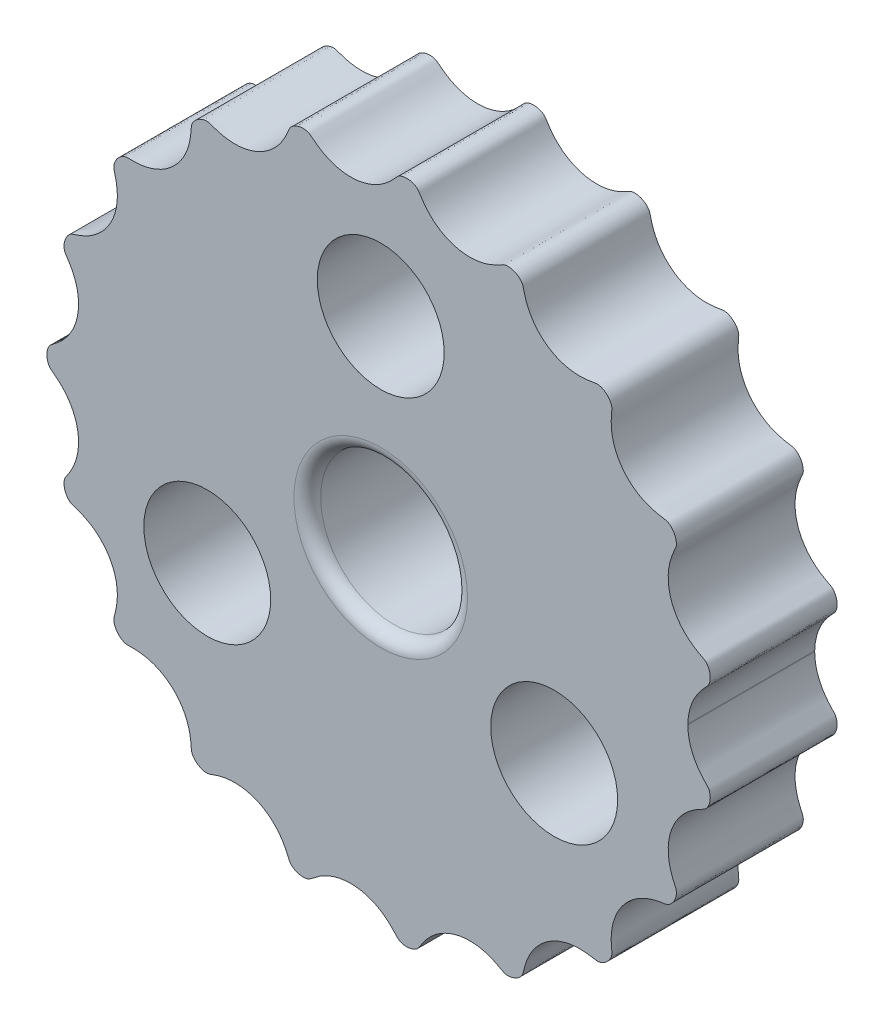
from build123d import *
from OCP.BRepAlgoAPI import BRepAlgoAPI_Cut
from OCP.TopTools import TopTools_ListOfShape

# Parameters (mm, degrees)
SKIZZE1_R                             = 25
AUFSATZ_LINEAR_AUSTRAGEN1_DEPTH       = 9.5
SCHNITT_LINEAR_AUSTRAGEN1_REACH       = 38.609
SKIZZE3_R                             = 0.5
SKIZZE9_OUTSIDE_W                     = 66.268
SKIZZE9_OUTSIDE_H                     = 66.263
SCHNITT_LINEAR_AUSTRAGEN6_DEPTH       = 10
SKIZZE23_R                            = 9
AUFSATZ_LINEAR_AUSTRAGEN2_DEPTH       = 0.5
SCHNITT_LINEAR_AUSTRAGEN11_DEPTH      = 0.5
SCHNITT_LINEAR_AUSTRAGEN11_DEPTH_BACK = 9.5
SKIZZE21_R                            = 5.5
VERRUNDUNG1_R                         = 1
SKIZZE22_R                            = 4.75
SCHNITT_LINEAR_AUSTRAGEN12_DEPTH      = 10


with BuildPart() as part:
    # Skizze1 → Aufsatz-Linear austragen1 (new body)
    with BuildSketch(Plane.XY):
        Circle(SKIZZE1_R)
    extrude(amount=AUFSATZ_LINEAR_AUSTRAGEN1_DEPTH)

    # Skizze3 → Schnitt-Linear austragen1 (cut, up to next)
    with BuildSketch(Plane.XY.offset(9.5), mode=Mode.PRIVATE) as schnitt_linear_austragen1_sk1:
        with Locations((0, 25)):
            Circle(SKIZZE3_R)
    schnitt_linear_austragen1_tool1 = extrude(schnitt_linear_austragen1_sk1.sketch, amount=-SCHNITT_LINEAR_AUSTRAGEN1_REACH, mode=Mode.PRIVATE) & part.part
    add(schnitt_linear_austragen1_tool1.solids().sort_by_distance((0, 25, 9.5))[0], mode=Mode.SUBTRACT)


with BuildPart() as schnitt_linear_austragen6_tool:
    # Skizze9 outside → Schnitt-Linear austragen6 (new body)
    with BuildSketch(Plane.XY.offset(9.5)):
        with Locations((0, -0.0025)):
            Rectangle(SKIZZE9_OUTSIDE_W, SKIZZE9_OUTSIDE_H)
        with BuildLine():
            Line((23.000445052, 0.060937419), (23, 0))
            add(Edge.make_bspline(
                [(23, 0), (23, -0.044349008), (23.001634544, -0.133544535), (23.008990115, -0.322210424), (23.028574614, -0.495064366), (23.065190093, -0.760458288), (23.128344661, -1.048281187), (23.256601687, -1.483985708), (23.455853251, -1.931799386), (23.680914036, -2.313218321), (23.909870513, -2.622445518), (24.07431226, -2.824110253), (24.206727121, -2.972267331), (24.333633451, -3.108358174), (24.446736551, -3.225635305), (24.524022768, -3.315918282), (24.582950142, -3.415606662), (24.624575555, -3.520829648), (24.663833231, -3.668623209), (24.685212658, -3.860905388), (24.673454969, -4.086945135), (24.620520353, -4.306815249), (24.546445793, -4.484777086), (24.469451436, -4.614376883), (24.403672696, -4.702418772), (24.331050319, -4.778425537), (24.251571347, -4.839472504), (24.137679259, -4.903870311), (24.000097219, -4.973956943), (23.84602848, -5.056457749), (23.635223866, -5.176178294), (23.393295921, -5.329179221), (23.121190787, -5.527614354), (22.83161764, -5.779890288), (22.56554989, -6.056903088), (22.261697169, -6.436060568), (21.954792305, -6.933189392), (21.724897296, -7.481107687), (21.582883975, -8.065310431), (21.527316325, -8.563551076), (21.521604829, -8.970764731), (21.554125075, -9.36939933), (21.621771537, -9.756104532), (21.708688359, -10.081815143), (21.799454454, -10.348274513), (21.884205293, -10.563157843), (21.95582729, -10.729022258), (22.024783379, -10.882887471), (22.092422873, -11.024820073), (22.140398235, -11.174553681), (22.150406377, -11.346817537), (22.12742522, -11.544222174), (22.061014784, -11.76185876), (21.950504113, -11.978770955), (21.808294479, -12.167418182), (21.661405911, -12.302203337), (21.524713944, -12.391379973), (21.414032836, -12.43721046), (21.330064744, -12.458579008), (21.232109488, -12.476052218), (21.121185626, -12.492228868), (20.992061937, -12.512135255), (20.837428097, -12.539026465), (20.676348543, -12.570851463), (20.465515415, -12.619761983), (20.12052129, -12.717519847), (19.653901317, -12.897202897), (19.089906306, -13.210945732), (18.495681708, -13.693863685), (17.979768758, -14.303268377), (17.581791087, -15.018361732), (17.359944866, -15.712485613), (17.275839331, -16.272804376), (17.257885306, -16.675733613), (17.260289119, -16.912297659), (17.268312239, -17.087096877), (17.280219561, -17.249790236), (17.292103623, -17.381570247), (17.303701486, -17.494353717), (17.312264608, -17.59519884), (17.314827323, -17.684032965), (17.303731872, -17.784796247), (17.272764928, -17.89463724), (17.214331446, -18.035197831), (17.115684868, -18.199184234), (16.97055355, -18.369748736), (16.774094974, -18.530559906), (16.563256223, -18.644549245), (16.377147805, -18.704141919), (16.228010898, -18.718256331), (16.102397709, -18.706443721), (15.982650488, -18.684743591), (15.837019497, -18.658148732), (15.66401259, -18.629235343), (15.482546813, -18.604172907), (15.250492461, -18.580238466), (14.967572009, -18.565542892), (14.542882776, -18.572942029), (14.069257686, -18.636089462), (13.604258599, -18.755934349), (13.066613534, -18.966719819), (12.627823596, -19.205194372), (12.214900787, -19.503646661), (11.838876435, -19.858554155), (11.558257701, -20.183825318), (11.315746611, -20.530340865), (11.111529005, -20.892984657), (10.966201461, -21.21922683), (10.864967944, -21.499403505), (10.794070352, -21.732891274), (10.751061312, -21.893706864), (10.716991714, -22.032228461), (10.686714115, -22.158984424), (10.6596415, -22.274087772), (10.613482868, -22.409752989), (10.527338836, -22.535688011), (10.427360762, -22.644235621), (10.291112437, -22.758327008), (10.126481227, -22.862491763), (9.947040294, -22.939957105), (9.758065088, -22.988506338), (9.580990884, -23.009043361), (9.446037355, -23.007367015), (9.322218618, -22.98832781), (9.214984001, -22.94936695), (9.136712494, -22.910504045), (9.037412358, -22.855573454), (8.916331447, -22.786743456), (8.770400294, -22.708163136), (8.599394122, -22.621424072), (8.296890057, -22.482075538), (7.936423258, -22.348806181), (7.514581595, -22.240173425), (7.031331339, -22.175898472), (6.63282472, -22.160659511), (6.229783332, -22.183593355), (5.826015405, -22.24628189), (5.425311076, -22.349560047), (5.032027225, -22.494084861), (4.656518257, -22.676660873), (4.302267209, -22.894831043), (3.975506648, -23.142933834), (3.677721892, -23.416820254), (3.44405137, -23.674800098), (3.263982058, -23.904047687), (3.127014139, -24.097398487), (3.026037187, -24.249605204), (2.943370251, -24.379361317), (2.877121162, -24.486036845), (2.810740935, -24.57879713), (2.74416189, -24.652300533), (2.654279715, -24.721400662), (2.517169909, -24.800702807), (2.343070205, -24.869762739), (2.128967514, -24.917212113), (1.910391133, -24.925657676), (1.725434514, -24.904879453), (1.559739423, -24.86337266), (1.427196326, -24.812252919), (1.301753294, -24.737435115), (1.191905153, -24.625420932), (1.092920189, -24.51260355), (0.986207514, -24.3949086), (0.871449748, -24.27279856), (0.716656542, -24.117338482), (0.516618525, -23.934026062), (0.194350851, -23.67521298), (-0.281567512, -23.37339053), (-0.887269543, -23.103703015), (-1.633020944, -22.921923215), (-2.411936918, -22.880032942), (-3.183772753, -22.98328489), (-3.829023204, -23.195281934), (-4.2988972, -23.430962009), (-4.616564859, -23.630167647), (-4.823559306, -23.774552149), (-4.97774687, -23.891482046), (-5.119347714, -24.003691962), (-5.242224002, -24.103909003), (-5.336784037, -24.17043694), (-5.438268301, -24.218274505), (-5.542753751, -24.249603187), (-5.686937903, -24.275637376), (-5.871538478, -24.282233578), (-6.086374705, -24.256198966), (-6.293131419, -24.192746417), (-6.459711563, -24.112913075), (-6.600609431, -24.020448435), (-6.711181251, -23.927151216), (-6.796582984, -23.824147974), (-6.850770436, -23.71583568), (-6.898420406, -23.605777644), (-6.947365407, -23.488164192), (-7.008561783, -23.346866721), (-7.084251644, -23.183019072), (-7.185293459, -22.981995225), (-7.317773933, -22.747121988), (-7.49148797, -22.481034064), (-7.715928329, -22.192185427), (-7.968344871, -21.919017194), (-8.248406659, -21.665143187), (-8.561039816, -21.429310586), (-8.999973335, -21.15936401), (-9.485228438, -20.94396874), (-10.005750728, -20.794854161), (-10.5400902, -20.718700851), (-10.966382178, -20.701695058), (-11.385971488, -20.726307169), (-11.744136072, -20.781871828), (-12.040715619, -20.850768976), (-12.280072238, -20.919948378), (-12.464451491, -20.980432418), (-12.618960453, -21.034692841), (-12.744339362, -21.081252299), (-12.843197189, -21.112699229), (-12.914777695, -21.129342332), (-13.015493456, -21.140932804), (-13.160661859, -21.134055928), (-13.345844593, -21.094667271), (-13.56260646, -21.005188433), (-13.772683813, -20.869959052), (-13.946323804, -20.707939025), (-14.067019069, -20.543934653), (-14.143263724, -20.390738491), (-14.177226476, -20.250634214), (-14.186913508, -20.119401386), (-14.198440689, -19.946405008), (-14.213530015, -19.757442916), (-14.235675307, -19.559977047), (-14.274437993, -19.309568767), (-14.348423441, -18.950696656), (-14.498793866, -18.460238452), (-14.782089579, -17.861430032), (-15.234748365, -17.229911899), (-15.812344032, -16.679668351), (-16.491481174, -16.245685384), (-17.151171767, -15.98558094), (-17.688427228, -15.865276912), (-18.07785431, -15.818698105), (-18.344365358, -15.800803267), (-18.55154879, -15.796411929), (-18.747233389, -15.797098718), (-18.919214302, -15.801313033), (-19.042965023, -15.798032434), (-19.158541295, -15.774162573), (-19.263868768, -15.734188884), (-19.3980896, -15.664341865), (-19.552411122, -15.552423471), (-19.709792298, -15.394155651), (-19.835538635, -15.210365782), (-19.917456357, -15.039169872), (-19.969403098, -14.874816471), (-19.994190258, -14.740899926), (-19.994061908, -14.609119869), (-19.96216239, -14.459382142), (-19.920895394, -14.313172891), (-19.877538048, -14.147042514), (-19.822738803, -13.915360041), (-19.770338499, -13.638779931), (-19.729787287, -13.309541458), (-19.715499442, -12.931565797), (-19.734288413, -12.553576969), (-19.78648075, -12.177103437), (-19.872494472, -11.805088171), (-20.023495245, -11.347840311), (-20.235452427, -10.900740033), (-20.506081593, -10.477888045), (-20.831339838, -10.089797059), (-21.129561467, -9.798398433), (-21.449341767, -9.541949139), (-21.785901305, -9.320723048), (-22.090756042, -9.157591612), (-22.354079166, -9.039521408), (-22.57449546, -8.953373927), (-22.748877752, -8.891937388), (-22.912531083, -8.836937192), (-23.066356684, -8.789685219), (-23.212715882, -8.723861285), (-23.348770452, -8.613260744), (-23.480006336, -8.461017062), (-23.595931294, -8.263067795), (-23.680634411, -8.033492463), (-23.722308403, -7.802011304), (-23.721628367, -7.601527638), (-23.693635989, -7.437177019), (-23.645884227, -7.311299551), (-23.58698665, -7.21312039), (-23.50464466, -7.091898831), (-23.413480121, -6.955895234), (-23.316990468, -6.805530999), (-23.195404595, -6.600975755), (-23.068720652, -6.363313462), (-22.938312571, -6.075672915), (-22.783932861, -5.645082693), (-22.656015316, -5.100755854), (-22.599242968, -4.422068125), (-22.682573218, -3.620850866), (-22.927187084, -2.830849576), (-23.281762934, -2.183591871), (-23.6362768, -1.730779958), (-23.922117546, -1.436607135), (-24.101102734, -1.272218319), (-24.239026842, -1.154624124), (-24.371984778, -1.048237606), (-24.482308167, -0.963016223), (-24.57797062, -0.891541044), (-24.661991507, -0.827034417), (-24.732333337, -0.767244059), (-24.800898907, -0.690159367), (-24.861333187, -0.593231274), (-24.925032547, -0.457300089), (-24.978883512, -0.278375099), (-25.007975239, -0.061527264), (-24.998029137, 0.156872346), (-24.961603162, 0.339906687), (-24.906642074, 0.50012632), (-24.850441317, 0.615615614), (-24.783182463, 0.713841399), (-24.70612467, 0.790339655), (-24.641199481, 0.843342445), (-24.554870828, 0.908952697), (-24.448719227, 0.988664196), (-24.324236971, 1.08551779), (-24.183292784, 1.201125684), (-24.010485379, 1.353122041), (-23.81108179, 1.546943796), (-23.594560374, 1.787959427), (-23.371493508, 2.082915142), (-23.173407473, 2.397599431), (-23.002579424, 2.730283971), (-22.825060162, 3.168494616), (-22.696921594, 3.643219257), (-22.627743718, 4.144164769), (-22.624177416, 4.661685067), (-22.666363477, 5.09510154), (-22.751865401, 5.517351943), (-22.877747992, 5.924389933), (-23.019278499, 6.262452411), (-23.158709609, 6.535601458), (-23.284362722, 6.752410897), (-23.3882676, 6.916947859), (-23.488830891, 7.070166759), (-23.587535901, 7.210756821), (-23.671246821, 7.356766871), (-23.714168117, 7.530883328), (-23.726069468, 7.730855757), (-23.699502836, 7.95346433), (-23.630318379, 8.183104328), (-23.52633356, 8.390805115), (-23.408217078, 8.549040856), (-23.291190018, 8.662484079), (-23.187013266, 8.733895955), (-23.096821148, 8.775794948), (-22.981629081, 8.815868272), (-22.848401699, 8.858322888), (-22.69712753, 8.909663583), (-22.487141415, 8.985853442), (-22.243476665, 9.086475268), (-21.966172973, 9.220958126), (-21.659597337, 9.400507491), (-21.366019488, 9.606283221), (-21.015068462, 9.899172124), (-20.616439007, 10.319113026), (-20.277075182, 10.810519886), (-20.014381412, 11.363643533), (-19.854230856, 11.866250836), (-19.76733511, 12.278862528), (-19.722218727, 12.69227238), (-19.716907846, 13.102353212), (-19.745142047, 13.455174831), (-19.790240094, 13.74942761), (-19.839418258, 13.987801772), (-19.883928641, 14.171816656), (-19.924430221, 14.326336612), (-19.959635946, 14.452042245), (-19.981490611, 14.550865907), (-19.991146558, 14.621917303), (-19.993465617, 14.72171627), (-19.974186216, 14.864320272), (-19.919540962, 15.044506214), (-19.812527244, 15.25216623), (-19.679411984, 15.425448939), (-19.543747518, 15.55574001), (-19.401745818, 15.660735954), (-19.278658713, 15.729274103), (-19.150362589, 15.779380876), (-19.024594963, 15.798486978), (-18.926980599, 15.800538574), (-18.813257446, 15.799080978), (-18.683627696, 15.796922513), (-18.53204173, 15.796944362), (-18.31062943, 15.802325062), (-18.041284621, 15.820863743), (-17.724801817, 15.862809117), (-17.364733963, 15.94101113), (-16.917774924, 16.078626012), (-16.397352611, 16.308512891), (-15.823885698, 16.673447375), (-15.248465863, 17.213007475), (-14.783027937, 17.854203567), (-14.487819371, 18.482693114), (-14.3350991, 18.99858497), (-14.262711958, 19.375130086), (-14.226859149, 19.630575355), (-14.20749639, 19.827410906), (-14.193630668, 20.011616761), (-14.183967321, 20.173300433), (-14.169665264, 20.290528491), (-14.13620014, 20.400514429), (-14.087337219, 20.501498285), (-14.005949224, 20.629435105), (-13.880393847, 20.774171639), (-13.70771107, 20.918241132), (-13.512733191, 21.027567196), (-13.335015199, 21.093885416), (-13.164685419, 21.131095174), (-13.023217422, 21.144361796), (-12.881689292, 21.12758481), (-12.746913763, 21.081662976), (-12.631497009, 21.03976391), (-12.500061398, 20.992972587), (-12.351873906, 20.943093342), (-12.141323701, 20.87807499), (-11.86553961, 20.807502895), (-11.538863443, 20.746804727), (-11.161625373, 20.709663429), (-10.783309446, 20.705631746), (-10.303777308, 20.743163442), (-9.735365541, 20.858384867), (-9.18181952, 21.063324831), (-8.660831733, 21.356277131), (-8.259912327, 21.654194829), (-7.958145103, 21.92757187), (-7.687531539, 22.224301823), (-7.478169682, 22.501251308), (-7.318010029, 22.749249931), (-7.20056761, 22.955585939), (-7.116178939, 23.117827482), (-7.040056142, 23.277507391), (-6.979187413, 23.414280948), (-6.928975482, 23.532232778), (-6.882870247, 23.641734547), (-6.839615539, 23.742450967), (-6.773171762, 23.858311637), (-6.65282957, 23.982657264), (-6.491082256, 24.099618345), (-6.284788497, 24.198233347), (-6.048922103, 24.263470899), (-5.812488054, 24.285813995), (-5.613326656, 24.267901929), (-5.455447069, 24.226628527), (-5.347527378, 24.175192548), (-5.275554517, 24.127519588), (-5.196283273, 24.066745711), (-5.108397036, 23.995456259), (-5.005207665, 23.913288922), (-4.87956659, 23.816992501), (-4.745849829, 23.719619426), (-4.565670719, 23.597260564), (-4.257925449, 23.409520833), (-3.806481978, 23.188277614), (-3.189696877, 22.987508405), (-2.4297018, 22.881184216), (-1.632799656, 22.918771452), (-0.841139522, 23.113533128), (-0.185417958, 23.421013674), (0.279913741, 23.737791045), (0.586090336, 23.99639661), (0.75723351, 24.157626572), (0.879528328, 24.281299661), (0.990419271, 24.399613911), (1.078774774, 24.497056472), (1.153438544, 24.581504203), (1.221511196, 24.655596922), (1.284909504, 24.717121913), (1.365964253, 24.776451302), (1.466534589, 24.827405356), (1.607306031, 24.879028125), (1.791189755, 24.917323788), (2.010918157, 24.927456604), (2.228353918, 24.898176477), (2.407586515, 24.845650382), (2.563497119, 24.775949581), (2.678679926, 24.706441913), (2.777632399, 24.621649165), (2.853019608, 24.522023291), (2.908931221, 24.435321014), (2.974078542, 24.33121551), (3.051284656, 24.211060966), (3.167299359, 24.037823409), (3.331351344, 23.813630352), (3.541173762, 23.562291848), (3.803043157, 23.296719614), (4.086707511, 23.0547537), (4.391118971, 22.837513314), (4.714531329, 22.647175745), (5.143388574, 22.44428436), (5.609939139, 22.289692853), (6.103243803, 22.192847895), (6.613571115, 22.159739929), (7.039969066, 22.175523991), (7.45596771, 22.23304208), (7.857753737, 22.32901848), (8.19346564, 22.442983226), (8.465946947, 22.557985394), (8.684156853, 22.663374396), (8.851360353, 22.751583463), (9.006295735, 22.836489131), (9.148436637, 22.919582058), (9.30082606, 22.986899093), (9.45183871, 23.008270961), (9.59966399, 23.008128279), (9.776752969, 22.984634027), (9.965730297, 22.933371674), (10.144919716, 22.852814285), (10.309053586, 22.745466512), (10.44407308, 22.627824749), (10.53407695, 22.526397212), (10.603175592, 22.421236657), (10.6459465, 22.314934112), (10.669806717, 22.230421269), (10.69653886, 22.119567765), (10.728369147, 21.983278147), (10.769645086, 21.821863909), (10.822364317, 21.636487902), (10.926010427, 21.318121266), (11.074042685, 20.961211254), (11.282430556, 20.575963656), (11.565773855, 20.176091831), (11.827322448, 19.8724018), (12.119436256, 19.592389031), (12.44040703, 19.339697956), (12.876661539, 19.060768141), (13.347404564, 18.841416397), (13.841354543, 18.686544703), (14.346562303, 18.597669529), (14.697822311, 18.569296169), (14.998334673, 18.567816526), (15.242436954, 18.580630094), (15.431926482, 18.598274406), (15.616282199, 18.622023152), (15.795573094, 18.650999392), (15.962851102, 18.680431182), (16.118798238, 18.711409079), (16.263399958, 18.718550064), (16.391914742, 18.695708751), (16.543403207, 18.648374892), (16.712767044, 18.566287549), (16.893222658, 18.439957308), (17.047688615, 18.283639814), (17.157623063, 18.132363306), (17.238699297, 17.981533239), (17.290435538, 17.848540597), (17.318850043, 17.704467195), (17.309288654, 17.547054192), (17.293438171, 17.396783532), (17.279126309, 17.237718302), (17.26723479, 17.070006462), (17.258112105, 16.849933903), (17.259396139, 16.577416432), (17.288600546, 16.163150247), (17.391413432, 15.606121227), (17.607063674, 14.97582132), (17.98278944, 14.304662619), (18.482355126, 13.706633868), (19.081060914, 13.213737282), (19.671334612, 12.886965306), (20.160022126, 12.703434456), (20.519491246, 12.605928218), (20.764371272, 12.552105386), (20.953603627, 12.518237265), (21.13087845, 12.490311557), (21.286821711, 12.467902297), (21.399022085, 12.443218823), (21.502531078, 12.400834029), (21.596296463, 12.345018644), (21.713376754, 12.256098562), (21.843670156, 12.12380665), (21.970236318, 11.946885117), (22.06339444, 11.750449289), (22.117045015, 11.572589064), (22.143556613, 11.405366661), (22.148999212, 11.259824084), (22.129043967, 11.126677452), (22.084453838, 11.01317314), (22.035042439, 10.903006381), (21.981626051, 10.786711836), (21.91903893, 10.645419245), (21.84988298, 10.47817838), (21.770611386, 10.266643879), (21.68784118, 10.008603655), (21.610333735, 9.698628805), (21.550896661, 9.335505546), (21.522392058, 8.962605117), (21.527219116, 8.582673391), (21.578650743, 8.086551566), (21.697244437, 7.584617866), (21.886538483, 7.090537103), (22.145664856, 6.619857546), (22.390928041, 6.266159782), (22.666569586, 5.943750333), (22.967923595, 5.654097849), (23.25030844, 5.429986184), (23.500842393, 5.259692028), (23.712869035, 5.131359544), (23.881370584, 5.03731738), (24.02514823, 4.960864369), (24.143671879, 4.900496862), (24.233172759, 4.849199279), (24.293457338, 4.807893364), (24.370004649, 4.741544045), (24.46329889, 4.629697949), (24.559856625, 4.465993302), (24.640716486, 4.244664413), (24.682999507, 3.997236547), (24.68042987, 3.758616145), (24.640301905, 3.558001792), (24.577641328, 3.397875329), (24.495553822, 3.278627925), (24.404839843, 3.182652043), (24.285118601, 3.056518562), (24.155837943, 2.916518174), (24.025294341, 2.765947581), (23.866886198, 2.565736427), (23.65265004, 2.267267024), (23.441960579, 1.901904987), (23.254560312, 1.474212846), (23.132014183, 1.060832925), (23.07056542, 0.786083879), (23.033498116, 0.534909185), (23.013150116, 0.367843981), (23.003809227, 0.188906137), (23.00106448, 0.103341973), (23.000445052, 0.060937419)],
                knots=[0.061461869, 0.061461869, 0.061461869, 0.061461869, 0.061461869, 0.062481445, 0.063501022, 0.064520599, 0.065540176, 0.067576099, 0.069612021, 0.073551422, 0.075470515, 0.076430061, 0.077389608, 0.078784848, 0.079482469, 0.080180089, 0.080675989, 0.08117189, 0.081811292, 0.082450694, 0.08375265, 0.085055896, 0.086348118, 0.086985531, 0.087622943, 0.088090233, 0.088557523, 0.089098343, 0.089639163, 0.090720802, 0.091672036, 0.09262327, 0.094525737, 0.096489951, 0.098454164, 0.100356812, 0.10225946, 0.10627407, 0.110193456, 0.112266353, 0.11433925, 0.11636582, 0.118392389, 0.12031835, 0.122244311, 0.123154673, 0.124065035, 0.124975397, 0.125885759, 0.126557793, 0.127229826, 0.128129419, 0.129330025, 0.130553094, 0.131784273, 0.133020441, 0.134060738, 0.134556345, 0.135051953, 0.13542865, 0.135805347, 0.136558742, 0.137312136, 0.13806553, 0.138967838, 0.139870147, 0.141674763, 0.145291833, 0.149024214, 0.152819048, 0.157032102, 0.161293195, 0.165413803, 0.167416944, 0.168418515, 0.169420086, 0.17018247, 0.170944853, 0.171707237, 0.172088429, 0.172469621, 0.172982902, 0.173496183, 0.174127309, 0.174758435, 0.17604715, 0.177334859, 0.178622361, 0.179842068, 0.180858382, 0.181239448, 0.181620514, 0.182382646, 0.18330634, 0.184230034, 0.185153729, 0.186077423, 0.188008327, 0.18993923, 0.193707134, 0.195683354, 0.197659574, 0.20156597, 0.203742577, 0.205919184, 0.20806606, 0.210212936, 0.212255549, 0.214298162, 0.215256984, 0.216215807, 0.21717463, 0.217654041, 0.218133452, 0.218844998, 0.219556544, 0.220526996, 0.221172682, 0.221818368, 0.223129836, 0.224442242, 0.225090176, 0.225738109, 0.226716692, 0.227156221, 0.227595749, 0.228035278, 0.228474807, 0.229441441, 0.230408075, 0.231374709, 0.232341343, 0.236155051, 0.238142566, 0.24013008, 0.242156938, 0.244183795, 0.24626956, 0.248355325, 0.25048654, 0.252617754, 0.25467391, 0.256730066, 0.258746558, 0.260763049, 0.261683387, 0.262603725, 0.263524064, 0.264444402, 0.264788533, 0.265132665, 0.265820928, 0.266439844, 0.267058759, 0.268319629, 0.269581881, 0.270836146, 0.271447043, 0.272057939, 0.273020901, 0.273690799, 0.274360697, 0.275205248, 0.276049798, 0.276894349, 0.2777389, 0.279628283, 0.281517665, 0.285218833, 0.289070237, 0.292926287, 0.296908335, 0.300855043, 0.304679262, 0.30654518, 0.307478139, 0.308411098, 0.309767191, 0.310445237, 0.311123283, 0.311606737, 0.312090192, 0.312701594, 0.313312996, 0.314554765, 0.315800337, 0.317040482, 0.317652611, 0.31826474, 0.319193909, 0.319946353, 0.320322575, 0.320698797, 0.321608324, 0.322517851, 0.323427377, 0.324336904, 0.326144367, 0.327951831, 0.329827833, 0.331703834, 0.333633724, 0.335563614, 0.337712362, 0.342077456, 0.344293801, 0.346434782, 0.348575763, 0.35066526, 0.352754757, 0.353732581, 0.354710404, 0.355688228, 0.356666052, 0.357036209, 0.357406366, 0.357776523, 0.35814668, 0.359078007, 0.360317761, 0.361577487, 0.362842327, 0.364094692, 0.365071945, 0.365667398, 0.366262852, 0.366989275, 0.367715697, 0.369168542, 0.370082205, 0.370995868, 0.372823194, 0.376552803, 0.38039774, 0.384282664, 0.388402025, 0.39253995, 0.396544231, 0.398493694, 0.399468425, 0.400443157, 0.401928453, 0.402671102, 0.40341375, 0.403913987, 0.404414225, 0.405044338, 0.405674452, 0.406957862, 0.408242485, 0.409517363, 0.410142295, 0.410767227, 0.411714908, 0.412247239, 0.41277957, 0.413844232, 0.4147777, 0.415711168, 0.417578104, 0.419518186, 0.421458267, 0.423328359, 0.425198451, 0.427172202, 0.429145952, 0.433023392, 0.43514143, 0.437259467, 0.439338207, 0.441416947, 0.443392934, 0.445368921, 0.446300588, 0.447232254, 0.448163921, 0.449095588, 0.449784402, 0.450473216, 0.451382192, 0.452593709, 0.453825325, 0.455063918, 0.456298746, 0.45730289, 0.457852187, 0.458401483, 0.459002613, 0.459603742, 0.460806002, 0.461704818, 0.462603633, 0.464401265, 0.466233534, 0.468065804, 0.471816322, 0.475642391, 0.479892351, 0.484207442, 0.48837624, 0.490424009, 0.491447893, 0.492471777, 0.493274866, 0.494077956, 0.494881045, 0.49528259, 0.495684135, 0.496211548, 0.496738961, 0.497357205, 0.497975449, 0.499231578, 0.500491381, 0.501743384, 0.50236159, 0.502979796, 0.503901788, 0.504323365, 0.504744942, 0.505166519, 0.505588096, 0.506506968, 0.507425839, 0.50834471, 0.509263581, 0.511146457, 0.513029333, 0.514869914, 0.516710496, 0.518634982, 0.520559469, 0.524389865, 0.526592624, 0.528795383, 0.530975029, 0.533154675, 0.535263554, 0.537372432, 0.53835327, 0.539334108, 0.540314945, 0.541295783, 0.542048107, 0.542800431, 0.543686288, 0.544870456, 0.546075751, 0.547288506, 0.548504624, 0.549524184, 0.550040358, 0.550556531, 0.551041008, 0.551525485, 0.55249444, 0.553378094, 0.554261748, 0.556029056, 0.557807622, 0.559586189, 0.561417743, 0.563249298, 0.567012976, 0.571225708, 0.573386361, 0.575547015, 0.577630159, 0.579713304, 0.581758364, 0.583803424, 0.584757415, 0.585711405, 0.586665396, 0.587619386, 0.587980597, 0.588341808, 0.588703018, 0.589064229, 0.589990986, 0.591225742, 0.592481897, 0.59374487, 0.59437508, 0.595005289, 0.596034993, 0.596580579, 0.597126165, 0.597562516, 0.597998867, 0.598871569, 0.599744271, 0.600616973, 0.602464647, 0.60431232, 0.606174746, 0.608037171, 0.611882783, 0.615747661, 0.619804001, 0.623847233, 0.627760176, 0.629667042, 0.630620475, 0.631573908, 0.632960263, 0.63365344, 0.634346617, 0.634839622, 0.635332626, 0.635965359, 0.636598093, 0.63788999, 0.639180695, 0.640471372, 0.641083557, 0.641695743, 0.642695231, 0.643314822, 0.643934412, 0.644554003, 0.645173594, 0.646129545, 0.647085497, 0.648997399, 0.650909523, 0.652821646, 0.654718686, 0.656615725, 0.660595184, 0.664475995, 0.66655082, 0.668625645, 0.670649627, 0.672673608, 0.674635575, 0.675616559, 0.676597542, 0.677459594, 0.678321645, 0.679183697, 0.679614722, 0.680045748, 0.680717948, 0.681390147, 0.682294064, 0.683500503, 0.684729773, 0.685967267, 0.687210114, 0.68825602, 0.68874479, 0.68923356, 0.689613898, 0.689994235, 0.690754909, 0.691515583, 0.692276257, 0.69318362, 0.694090983, 0.695905709, 0.699541039, 0.703294389, 0.707104333, 0.711296015, 0.715529056, 0.719622991, 0.721613785, 0.722609182, 0.723604579, 0.724362502, 0.725120424, 0.725878347, 0.726257308, 0.726636269, 0.727146511, 0.727656752, 0.728277518, 0.728898283, 0.730163027, 0.731428819, 0.732686728, 0.733300114, 0.733913501, 0.734868188, 0.73538728, 0.735906371, 0.736425463, 0.736944554, 0.73786553, 0.738786506, 0.740628457, 0.742543985, 0.744459512, 0.746297797, 0.748136082, 0.750075712, 0.752015342, 0.755850354, 0.758013558, 0.760176761, 0.762308008, 0.764439255, 0.766466447, 0.768493639, 0.769446296, 0.770398953, 0.771351609, 0.772304266, 0.773010518, 0.77371677, 0.774692014, 0.775340978, 0.775989942, 0.777308168, 0.778627356, 0.779278498, 0.779929639, 0.7809117, 0.781353356, 0.781795012, 0.782236668, 0.782678324, 0.783649926, 0.784621528, 0.785593129, 0.786564731, 0.79039886, 0.792397566, 0.794396271, 0.796431969, 0.798467667, 0.800543572, 0.802619477, 0.806855275, 0.808898188, 0.810941102, 0.812947147, 0.813950169, 0.814953191, 0.815868189, 0.816783186, 0.817698184, 0.818613182, 0.819297292, 0.819981402, 0.820603238, 0.821225074, 0.822491763, 0.823759871, 0.825019489, 0.825633476, 0.826247462, 0.827207841, 0.827885659, 0.828563477, 0.829410873, 0.830258269, 0.831105665, 0.83195306, 0.833851593, 0.835750126, 0.839469591, 0.84334196, 0.847211812, 0.851171733, 0.855089792, 0.858887816, 0.860741655, 0.861668574, 0.862595494, 0.863942523, 0.864616038, 0.865289552, 0.865770228, 0.866250904, 0.866865514, 0.867480124, 0.868728307, 0.869980404, 0.871226481, 0.871842593, 0.872458706, 0.873390393, 0.874149913, 0.874529673, 0.874909433, 0.875821436, 0.876733439, 0.877645443, 0.878557446, 0.880375808, 0.88219417, 0.884080941, 0.885967711, 0.887906445, 0.889845178, 0.894123322, 0.896327099, 0.898530875, 0.900658637, 0.902786399, 0.904865784, 0.90694517, 0.907917553, 0.908889936, 0.909862318, 0.910834701, 0.911202796, 0.911570891, 0.911938986, 0.912307081, 0.913242964, 0.914488698, 0.9157545, 0.91702529, 0.918282922, 0.919265523, 0.919863292, 0.920461062, 0.921190028, 0.921918995, 0.923376927, 0.924296159, 0.92521539, 0.927053853, 0.930802192, 0.932735308, 0.934668424, 0.935643402, 0.93661838, 0.937593358, 0.938568336, 0.938568336, 0.938568336, 0.938568336, 0.938568336], degree=4))
        make_face(mode=Mode.SUBTRACT)
    extrude(amount=-SCHNITT_LINEAR_AUSTRAGEN6_DEPTH)


with BuildPart() as part_1:
    add(part.part)

    # Schnitt-Linear austragen6: cut by schnitt_linear_austragen6_tool, with a tolerance
    schnitt_linear_austragen6_stock = TopTools_ListOfShape()
    schnitt_linear_austragen6_stock.Append(part_1.part.wrapped)
    schnitt_linear_austragen6_tools = TopTools_ListOfShape()
    schnitt_linear_austragen6_tools.Append(schnitt_linear_austragen6_tool.part.wrapped)
    schnitt_linear_austragen6_cut = BRepAlgoAPI_Cut()
    schnitt_linear_austragen6_cut.SetArguments(schnitt_linear_austragen6_stock)
    schnitt_linear_austragen6_cut.SetTools(schnitt_linear_austragen6_tools)
    schnitt_linear_austragen6_cut.SetFuzzyValue(0.00001)
    schnitt_linear_austragen6_cut.Build()
    add(Compound.cast(schnitt_linear_austragen6_cut.Shape()).solids(), mode=Mode.REPLACE)

    # Skizze23 → Aufsatz-Linear austragen2 (add)
    with BuildSketch(Plane(origin=(0, 0, 0), x_dir=(-1, 0, 0), z_dir=(0, 0, -1))):
        Circle(SKIZZE23_R)
    extrude(amount=AUFSATZ_LINEAR_AUSTRAGEN2_DEPTH)

    # Skizze21 → Schnitt-Linear austragen11 (cut, two sides: drawn at the far end of the back side and taken through both)
    with BuildSketch(Plane(origin=(0, 0, 0), x_dir=(-1, 0, 0), z_dir=(0, 0, -1)).offset(-SCHNITT_LINEAR_AUSTRAGEN11_DEPTH_BACK)):
        Circle(SKIZZE21_R)
    extrude(amount=SCHNITT_LINEAR_AUSTRAGEN11_DEPTH + SCHNITT_LINEAR_AUSTRAGEN11_DEPTH_BACK, mode=Mode.SUBTRACT)

    # Verrundung1
    verrundung1_edges = [part_1.edges().sort_by_distance(p)[0] for p in [
        (5.5, 0, 9.5),
        (5.5, 0, -0.5),
    ]]
    fillet(verrundung1_edges, radius=VERRUNDUNG1_R)

    # Skizze22 → Schnitt-Linear austragen12 (cut)
    with BuildSketch(Plane(origin=(0, 0, 0), x_dir=(-1, 0, 0), z_dir=(0, 0, -1))):
        with Locations((0, 15)):
            Circle(SKIZZE22_R)
        with Locations((12.990381057, -7.5)):
            Circle(SKIZZE22_R)
        with Locations((-12.990381057, -7.5)):
            Circle(SKIZZE22_R)
    extrude(amount=-SCHNITT_LINEAR_AUSTRAGEN12_DEPTH, mode=Mode.SUBTRACT)


solid = part_1.part
